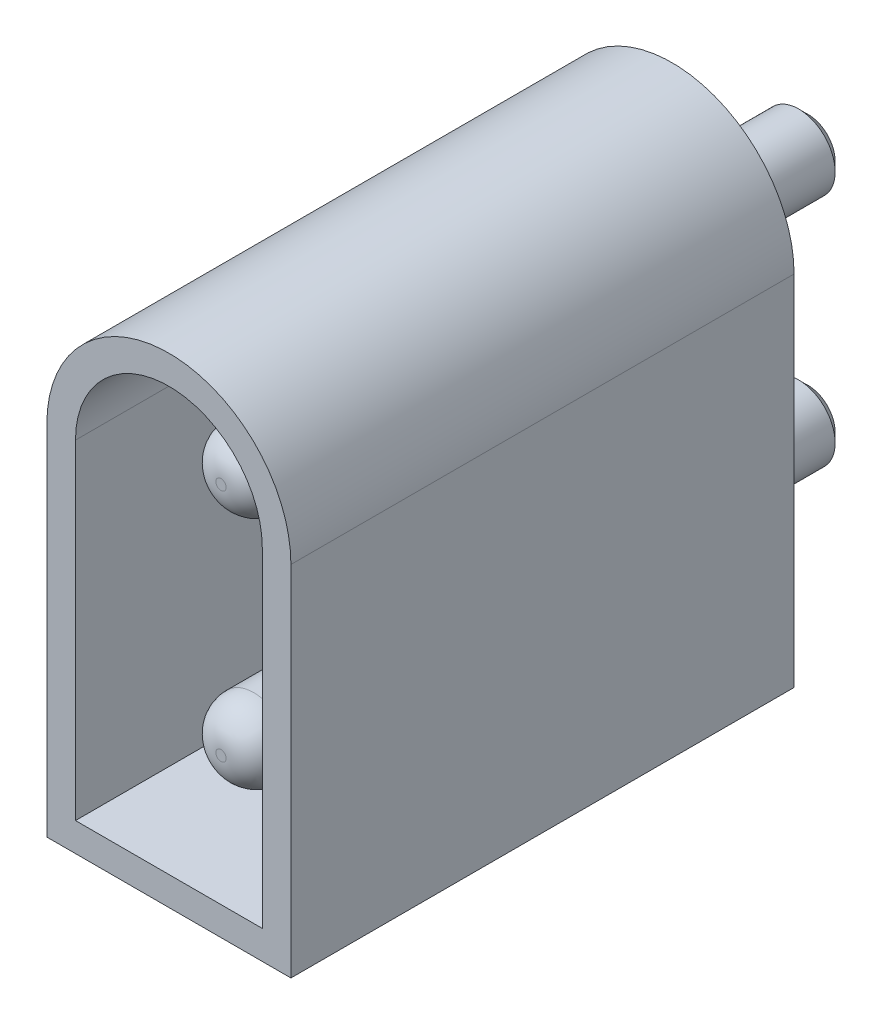
from build123d import *

# Parameters (mm, degrees)
SALIENTE_EXTRUIR1_DEPTH = 10.72
CROQUIS2_R              = 0.775
SALIENTE_EXTRUIR2_DEPTH = 2.9
CHAFL_N1_SIZE           = 0.2
VACIADO1_START          = 0.61
VACIADO1_DEPTH          = 10.11
VACIADO1_START_2        = -2.29
VACIADO1_2_OUTLINE_R    = 0.165
VACIADO1_2_DEPTH        = 2.9
CROQUIS4_R              = 0.81
SALIENTE_EXTRUIR4_DEPTH = 9
REDONDEO1_R             = 0.7


# Read off the part's stored shape, not the designer's step: Vaciado1
with BuildPart() as part:
    # Croquis1 → Saliente-Extruir1 (new body)
    with BuildSketch(Plane.XY):
        with BuildLine():
            Line((-2.6, 7.63), (-2.6, 0))
            Line((-2.6, 0), (2.6, 0))
            Line((2.6, 0), (2.6, 7.63))
            ThreePointArc((2.6, 7.63), (0, 10.23), (-2.6, 7.63))
        make_face()
    extrude(amount=SALIENTE_EXTRUIR1_DEPTH)

    # Croquis2 → Saliente-Extruir2 (add)
    with BuildSketch(Plane(origin=(0, 0, 0), x_dir=(-1, 0, 0), z_dir=(0, 0, -1))):
        with Locations((0, 7.25)):
            Circle(CROQUIS2_R)
        with Locations((0, 2.25)):
            Circle(CROQUIS2_R)
    extrude(amount=SALIENTE_EXTRUIR2_DEPTH)

    # Chaflán1
    chafl_n1_edges = [part.edges().sort_by_distance(p)[0] for p in [
        (0.775, 7.25, -2.9),
        (0.775, 2.25, -2.9),
    ]]
    chamfer(chafl_n1_edges, length=CHAFL_N1_SIZE)

    # Vaciado1 outline → Vaciado1 (cut)
    with BuildSketch(Plane.XY.offset(VACIADO1_START)):
        with BuildLine():
            ThreePointArc((1.99, 7.63), (0, 9.62), (-1.99, 7.63))
            Line((-1.99, 7.63), (-1.99, 0.61))
            Line((-1.99, 0.61), (1.99, 0.61))
            Line((1.99, 0.61), (1.99, 7.63))
        make_face()
    extrude(amount=VACIADO1_DEPTH, mode=Mode.SUBTRACT)

    # Vaciado1 2 outline → Vaciado1 2 (cut)
    with BuildSketch(Plane.XY.offset(VACIADO1_START_2)):
        with Locations((0, 7.25)):
            Circle(VACIADO1_2_OUTLINE_R)
        with Locations((0, 2.25)):
            Circle(VACIADO1_2_OUTLINE_R)
    extrude(amount=VACIADO1_2_DEPTH, mode=Mode.SUBTRACT)

    # Croquis4 → Saliente-Extruir4 (add)
    with BuildSketch(Plane.XY.offset(0.61)):
        with Locations(Location((0, 2.25, 0), (0, 0, 180))):
            Circle(CROQUIS4_R)
        with Locations(Location((0, 7.25, 0), (0, 0, 180))):
            Circle(CROQUIS4_R)
    extrude(amount=SALIENTE_EXTRUIR4_DEPTH)

    # Redondeo1
    redondeo1_edges = [part.edges().sort_by_distance(p)[0] for p in [
        (0.81, 2.25, 9.61),
        (0.81, 7.25, 9.61),
    ]]
    fillet(redondeo1_edges, radius=REDONDEO1_R)


solid = part.part
